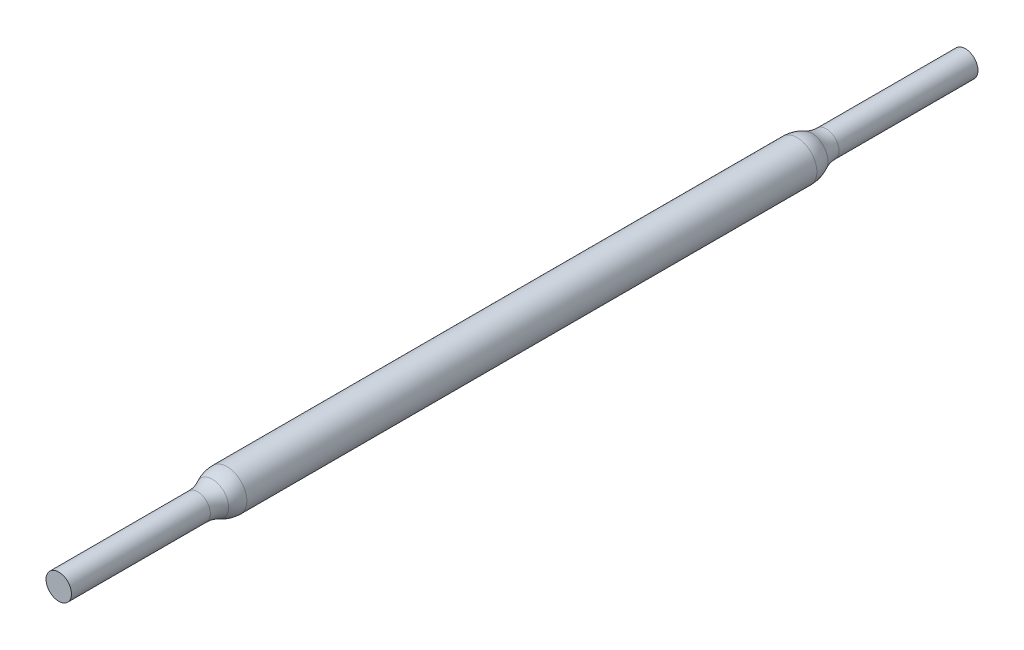
from build123d import *

# Parameters (mm, degrees)
SKETCH1_R           = 4
BOSS_EXTRUDE1_DEPTH = 50
SKETCH2_R           = 6.25
BOSS_EXTRUDE2_DEPTH = 185
SKETCH3_R           = 4
BOSS_EXTRUDE3_DEPTH = 50
FILLET1_R           = 10
FILLET2_R           = 10


with BuildPart() as part:
    # Sketch1 → Boss-Extrude1 (new body)
    with BuildSketch(Plane.XY):
        Circle(SKETCH1_R)
    extrude(amount=BOSS_EXTRUDE1_DEPTH)

    # Sketch2 → Boss-Extrude2 (add)
    with BuildSketch(Plane.XY.offset(50)):
        Circle(SKETCH2_R)
    extrude(amount=BOSS_EXTRUDE2_DEPTH)

    # Sketch3 → Boss-Extrude3 (add)
    with BuildSketch(Plane.XY.offset(235)):
        Circle(SKETCH3_R)
    extrude(amount=BOSS_EXTRUDE3_DEPTH)

    # Fillet1
    # the kernel refuses this fillet: 10 mm, written as the material it adds along each edge
    with BuildSketch(Plane(origin=(0, 0, 235), x_dir=(1, 0, 0), z_dir=(0, -1, 0))) as fillet1_piece_1:
        with BuildLine():
            CenterArc((14, 6.31961233), FILLET1_R, 180, 39.194967426)
            Line((4, 6.31961233), (3.8, 6.31961233))
            Line((3.8, 6.31961233), (3.8, 0))
            Line((3.8, 0), (4, -0.2))
            ThreePointArc((4, -0.2), (5.125, -0.2), (6.095, -0.126392247))
            Line((6.095, -0.126392247), (6.25, 0))
        make_face()
    revolve(axis=Axis((0, 0, 235), (0, 0, 1)))
    with BuildSketch(Plane(origin=(0, 0, 50), x_dir=(1, 0, 0), z_dir=(0, -1, 0))) as fillet1_piece_2:
        with BuildLine():
            CenterArc((14, -6.31961233), FILLET1_R, 140.805032574, 39.194967426)
            Line((4, -6.31961233), (3.8, -6.31961233))
            Line((3.8, -6.31961233), (3.8, 0))
            Line((3.8, 0), (4, 0.2))
            ThreePointArc((4, 0.2), (5.125, 0.2), (6.095, 0.126392247))
            Line((6.095, 0.126392247), (6.25, 0))
        make_face()
    revolve(axis=Axis((0, 0, 50), (0, 0, 1)))

    # Fillet2
    fillet2_edges = [part.edges().sort_by_distance(p)[0] for p in [
        (-6.25, 0, 50),
        (-6.25, 0, 235),
    ]]
    fillet(fillet2_edges, radius=FILLET2_R)


solid = part.part
